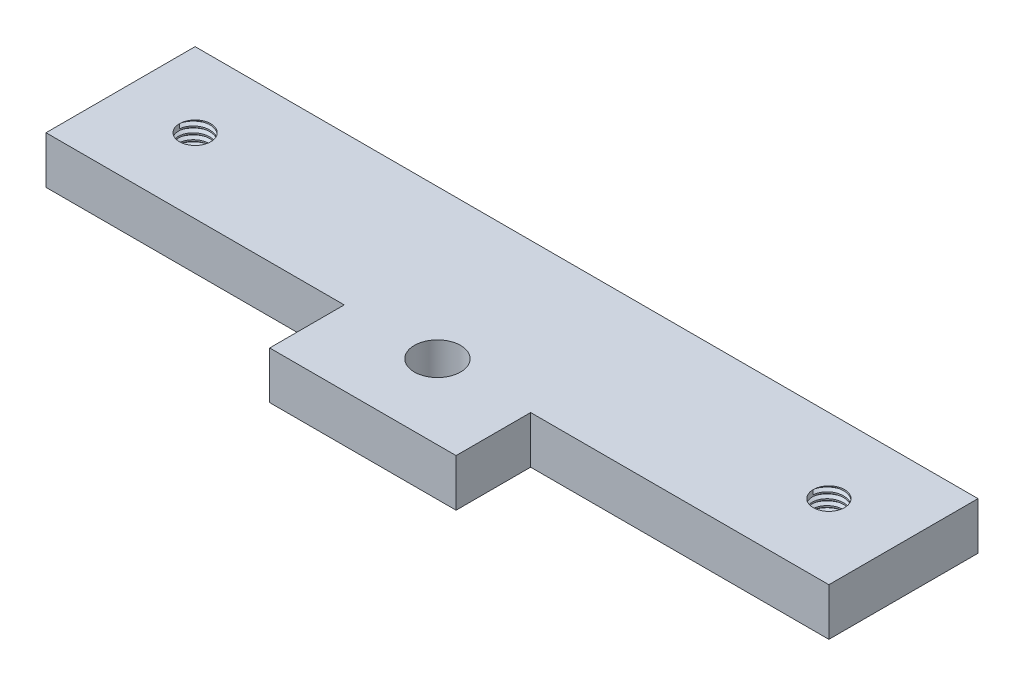
from build123d import *

# Parameters (mm, degrees)
BOSS_EXTRUDE1_DEPTH      = 3.175
BOSS_EXTRUDE1_DEPTH_BACK = 3.175
SKETCH1_R                = 3.1
SKETCH1_R_2              = 2.1
THREAD1_PITCH            = 0.8
THREAD2_PITCH            = 0.8


with BuildPart() as part:
    # Sketch1 → Boss-Extrude1 (new, two sides: drawn at the far end of the back side and taken through both)
    with BuildSketch(Plane(origin=(0, 0, 0), x_dir=(1, 0, 0), z_dir=(0, 1, 0)).offset(-BOSS_EXTRUDE1_DEPTH_BACK)):
        Polygon((-12.5, 0), (-12.5, -10), (12.5, -10), (12.5, 0), (52.5, 0), (52.5, 20), (-52.5, 20), (-52.5, 0), align=None)
        with Locations(Location((0, 0, 0), (0, 0, 270))):
            Circle(SKETCH1_R, mode=Mode.SUBTRACT)
        with Locations(Location((42.5, 10, 0), (0, 0, 270))):
            Circle(SKETCH1_R_2, mode=Mode.SUBTRACT)
        with Locations(Location((-42.5, 10, 0), (0, 0, 270))):
            Circle(SKETCH1_R_2, mode=Mode.SUBTRACT)
    extrude(amount=BOSS_EXTRUDE1_DEPTH + BOSS_EXTRUDE1_DEPTH_BACK)

    # Thread1: the profile of Thread Profile1 profile screwed along a right-hand helix of 12.5 turns, 8 arcs to a turn; built about Z, then put on its axis
    thread1_z = Axis((0, 0, 0), (0, 0, 1))
    thread1_corners = [(2.0997, 0, -0.000173205), (2.5330127, 0, 0.249999999), (2.5330127, 0, 0.349999999), (2.0997, 0, 0.600173203)]
    with BuildLine(mode=Mode.PRIVATE) as thread1_profile:
        Line(thread1_corners[0], thread1_corners[1])
        Line(thread1_corners[1], thread1_corners[2])
        Line(thread1_corners[2], thread1_corners[3])
        Line(thread1_corners[3], thread1_corners[0])
    thread1_cap = Face(thread1_profile.wire())
    thread1_turn_angles = [0, 22.5, 45, 67.5, 90, 112.5, 135, 157.5, 180, 202.5, 225, 247.5, 270, 292.5, 315, 337.5, 360]
    thread1_turn_weights = [1, 0.9238795325112867, 1, 0.9238795325112867, 1, 0.9238795325112867, 1, 0.9238795325112867, 1, 0.9238795325112867, 1, 0.9238795325112867, 1, 0.9238795325112867, 1, 0.9238795325112867, 1]
    thread1_turn_rails = [Edge.make_bspline([Vector(p[0], p[1], 0).rotate(thread1_z, thread1_turn_angles[k]) / thread1_turn_weights[k] + Vector(0, 0, p[2] + THREAD1_PITCH * thread1_turn_angles[k] / 360) for k in range(17)], [0, 0, 0, 1, 1, 2, 2, 3, 3, 4, 4, 5, 5, 6, 6, 7, 7, 8, 8, 8], 2, thread1_turn_weights) for p in thread1_corners]
    thread1_turn_sides = [Face.make_surface_from_curves(thread1_turn_rails[p[0]], thread1_turn_rails[p[1]]) for p in [(0, 1), (1, 2), (2, 3), (3, 0)]]
    thread1_last_angles = [4320, 4342.5, 4365, 4387.5, 4410, 4432.5, 4455, 4477.5, 4500]
    thread1_last_weights = [1, 0.9238795325112867, 1, 0.9238795325112867, 1, 0.9238795325112867, 1, 0.9238795325112867, 1]
    thread1_last_rails = [Edge.make_bspline([Vector(p[0], p[1], 0).rotate(thread1_z, thread1_last_angles[k]) / thread1_last_weights[k] + Vector(0, 0, p[2] + THREAD1_PITCH * thread1_last_angles[k] / 360) for k in range(9)], [0, 0, 0, 1, 1, 2, 2, 3, 3, 4, 4, 4], 2, thread1_last_weights) for p in thread1_corners]
    thread1_last_sides = [Face.make_surface_from_curves(thread1_last_rails[p[0]], thread1_last_rails[p[1]]) for p in [(0, 1), (1, 2), (2, 3), (3, 0)]]
    thread1 = Plane(origin=(-42.5, 3.175, -10), x_dir=(-1, 0, 0), z_dir=(0, -1, 0)) * Solid(Shell([*[p.moved(Location((0, 0, THREAD1_PITCH * i))) for i in range(12) for p in thread1_turn_sides], *thread1_last_sides, thread1_cap, thread1_cap.rotate(thread1_z, 4500).moved(Location((0, 0, THREAD1_PITCH * 4500 / 360)))]))
    add(thread1, mode=Mode.SUBTRACT)

    # Thread2: the profile of Thread Profile2 profile screwed along a right-hand helix of 12.5 turns, 8 arcs to a turn; built about Z, then put on its axis
    thread2_z = Axis((0, 0, 0), (0, 0, 1))
    thread2_corners = [(2.0997, 0, -0.000173205), (2.5330127, 0, 0.249999999), (2.5330127, 0, 0.349999999), (2.0997, 0, 0.600173203)]
    with BuildLine(mode=Mode.PRIVATE) as thread2_profile:
        Line(thread2_corners[0], thread2_corners[1])
        Line(thread2_corners[1], thread2_corners[2])
        Line(thread2_corners[2], thread2_corners[3])
        Line(thread2_corners[3], thread2_corners[0])
    thread2_cap = Face(thread2_profile.wire())
    thread2_turn_angles = [0, 22.5, 45, 67.5, 90, 112.5, 135, 157.5, 180, 202.5, 225, 247.5, 270, 292.5, 315, 337.5, 360]
    thread2_turn_weights = [1, 0.9238795325112867, 1, 0.9238795325112867, 1, 0.9238795325112867, 1, 0.9238795325112867, 1, 0.9238795325112867, 1, 0.9238795325112867, 1, 0.9238795325112867, 1, 0.9238795325112867, 1]
    thread2_turn_rails = [Edge.make_bspline([Vector(p[0], p[1], 0).rotate(thread2_z, thread2_turn_angles[k]) / thread2_turn_weights[k] + Vector(0, 0, p[2] + THREAD2_PITCH * thread2_turn_angles[k] / 360) for k in range(17)], [0, 0, 0, 1, 1, 2, 2, 3, 3, 4, 4, 5, 5, 6, 6, 7, 7, 8, 8, 8], 2, thread2_turn_weights) for p in thread2_corners]
    thread2_turn_sides = [Face.make_surface_from_curves(thread2_turn_rails[p[0]], thread2_turn_rails[p[1]]) for p in [(0, 1), (1, 2), (2, 3), (3, 0)]]
    thread2_last_angles = [4320, 4342.5, 4365, 4387.5, 4410, 4432.5, 4455, 4477.5, 4500]
    thread2_last_weights = [1, 0.9238795325112867, 1, 0.9238795325112867, 1, 0.9238795325112867, 1, 0.9238795325112867, 1]
    thread2_last_rails = [Edge.make_bspline([Vector(p[0], p[1], 0).rotate(thread2_z, thread2_last_angles[k]) / thread2_last_weights[k] + Vector(0, 0, p[2] + THREAD2_PITCH * thread2_last_angles[k] / 360) for k in range(9)], [0, 0, 0, 1, 1, 2, 2, 3, 3, 4, 4, 4], 2, thread2_last_weights) for p in thread2_corners]
    thread2_last_sides = [Face.make_surface_from_curves(thread2_last_rails[p[0]], thread2_last_rails[p[1]]) for p in [(0, 1), (1, 2), (2, 3), (3, 0)]]
    thread2 = Plane(origin=(42.5, 3.175, -10), x_dir=(-1, 0, 0), z_dir=(0, -1, 0)) * Solid(Shell([*[p.moved(Location((0, 0, THREAD2_PITCH * i))) for i in range(12) for p in thread2_turn_sides], *thread2_last_sides, thread2_cap, thread2_cap.rotate(thread2_z, 4500).moved(Location((0, 0, THREAD2_PITCH * 4500 / 360)))]))
    add(thread2, mode=Mode.SUBTRACT)


solid = part.part
